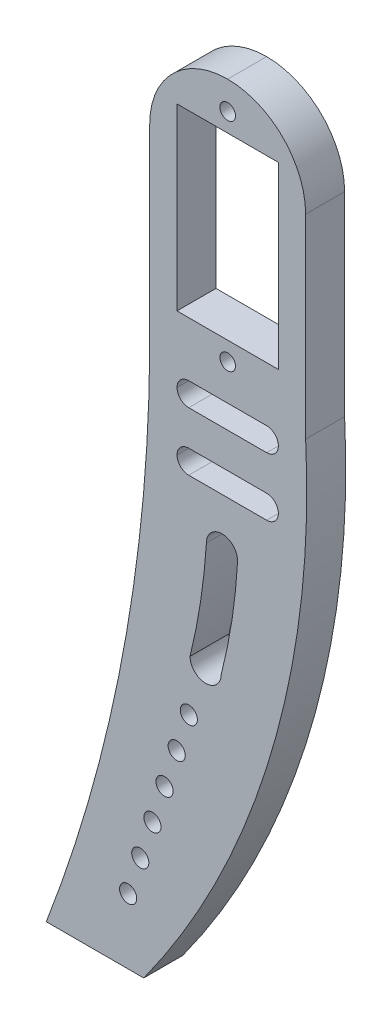
from build123d import *

# Parameters (mm, degrees)
SKETCH1_W           = 20
SKETCH1_H           = 35
SKETCH1_W_2         = 13
SKETCH1_H_2         = 23
BOSS_EXTRUDE1_DEPTH = 5
SKETCH2_R           = 1
CUT_EXTRUDE1_DEPTH  = 5
BOSS_EXTRUDE2_DEPTH = 5
FILLET1_R           = 10
SKETCH6_R           = 1.1
CUT_EXTRUDE2_DEPTH  = 10
SKETCH7_W           = 13
SKETCH7_H           = 3
CUT_EXTRUDE3_DEPTH  = 10
FILLET2_R           = 1.5


with BuildPart() as part:
    # Sketch1 → Boss-Extrude1 (new body)
    with BuildSketch(Plane.XY):
        Rectangle(SKETCH1_W, SKETCH1_H)
        Rectangle(SKETCH1_W_2, SKETCH1_H_2, mode=Mode.SUBTRACT)
    extrude(amount=BOSS_EXTRUDE1_DEPTH)

    # Sketch2 → Cut-Extrude1 (cut)
    with BuildSketch(Plane.XY.offset(5)):
        with Locations((0, 13.9)):
            Circle(SKETCH2_R)
        with Locations(Location((0, -13.9, 0), (0, 0, 180))):
            Circle(SKETCH2_R)
    extrude(amount=-CUT_EXTRUDE1_DEPTH, mode=Mode.SUBTRACT)

    # Sketch4 → Boss-Extrude2 (add)
    with BuildSketch(Plane.XY.offset(5)):
        with BuildLine():
            Line((0, -17.5), (-10, -17.5))
            ThreePointArc((-10, -17.5), (-13.470780797, -53.21636341), (-23.268193188, -87.737598108))
            Line((-23.268193188, -87.737598108), (-10.768193188, -87.737598108))
            ThreePointArc((-10.768193188, -87.737598108), (5.633525229, -54.39811862), (10, -17.5))
            Line((10, -17.5), (0, -17.5))
        make_face()
    extrude(amount=-BOSS_EXTRUDE2_DEPTH)

    # Fillet1
    fillet1_edges = [part.edges().sort_by_distance(p)[0] for p in [
        (-10, 17.5, 2.5),
        (10, 17.5, 2.5),
    ]]
    fillet(fillet1_edges, radius=FILLET1_R - 0.0001)  # a hair under: the kernel refuses the full size

    # Sketch6 → Cut-Extrude2 (cut)
    with BuildSketch(Plane.XY.offset(5)):
        with Locations((-12.768649296, -79.368399131)):
            Circle(SKETCH6_R)
        with BuildLine():
            ThreePointArc((1.273336761, -35.373649828), (-0.726663239, -33.373649828), (-2.726663239, -35.373649828))
            ThreePointArc((-2.726663239, -35.373649828), (-3.473502661, -42.250603024), (-4.826684161, -49.034344928))
            ThreePointArc((-4.826684161, -49.034344928), (-2.826684161, -51.034344928), (-0.826684161, -49.034344928))
            ThreePointArc((-0.826684161, -49.034344928), (0.561306745, -42.255954178), (1.273336761, -35.373649828))
        make_face()
        with Locations((-11.211408841, -74.617083296)):
            Circle(SKETCH6_R)
        with Locations((-9.654168385, -69.865767461)):
            Circle(SKETCH6_R)
        with Locations((-8.09692793, -65.114451626)):
            Circle(SKETCH6_R)
        with Locations((-6.539687475, -60.363135791)):
            Circle(SKETCH6_R)
        with Locations((-4.98244702, -55.611819955)):
            Circle(SKETCH6_R)
    extrude(amount=-CUT_EXTRUDE2_DEPTH, mode=Mode.SUBTRACT)

    # Sketch7 → Cut-Extrude3 (cut)
    with BuildSketch(Plane.XY.offset(5)):
        with Locations((0, -27.5)):
            Rectangle(SKETCH7_W, SKETCH7_H)
        with Locations((0, -20)):
            Rectangle(SKETCH7_W, SKETCH7_H)
    extrude(amount=-CUT_EXTRUDE3_DEPTH, mode=Mode.SUBTRACT)

    # Fillet2
    fillet2_edges = [part.edges().sort_by_distance(p)[0] for p in [
        (6.5, -26, 2.5),
        (6.5, -29, 2.5),
        (-6.5, -29, 2.5),
        (-6.5, -26, 2.5),
        (6.5, -21.5, 2.5),
        (6.5, -18.5, 2.5),
        (-6.5, -21.5, 2.5),
        (-6.5, -18.5, 2.5),
    ]]
    fillet(fillet2_edges, radius=FILLET2_R - 0.0001)  # a hair under: the kernel refuses the full size


solid = part.part
